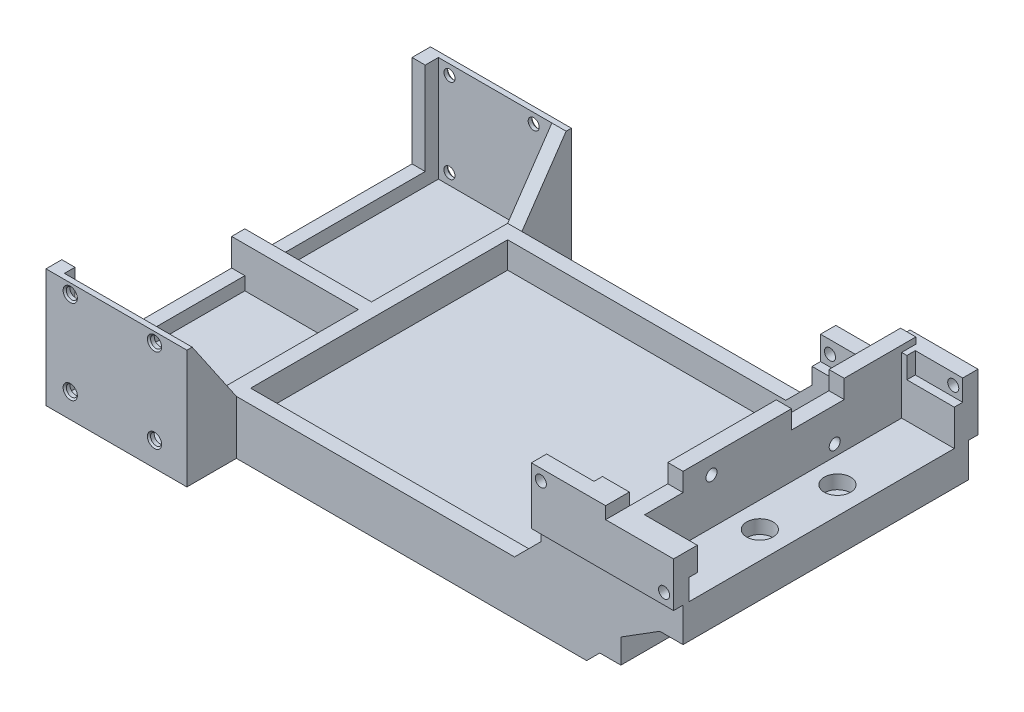
from build123d import *

# Parameters (mm, degrees)
SKETCH5_W                 = 70.3
SKETCH5_H                 = 48.8
BOSS_EXTRUDE2_DEPTH       = 5
BOSS_EXTRUDE4_START       = 2.7
BOSS_EXTRUDE4_DEPTH       = 2.7
BOSS_EXTRUDE5_DEPTH       = 1.575
SKETCH8_W                 = 17.5
SKETCH8_H                 = 54.2
BOSS_EXTRUDE6_DEPTH       = 6.5
BOSS_EXTRUDE7_DEPTH       = 54.2
SKETCH10_W                = 70.3
SKETCH10_H                = 48.8
CUT_EXTRUDE1_DEPTH        = 107.297545244
BOSS_EXTRUDE8_DEPTH       = 5
BOSS_EXTRUDE9_DEPTH       = 5
SKETCH13_W                = 4.5
SKETCH13_H                = 54.2
BOSS_EXTRUDE10_DEPTH      = 12
SKETCH15_R                = 1
CUT_EXTRUDE3_DEPTH        = 107.663316679
SKETCH16_R                = 2.5
CUT_EXTRUDE4_DEPTH        = 2.6
SKETCH17_W                = 3
SKETCH17_H                = 54.2
CUT_EXTRUDE5_DEPTH        = 107.663316679
SKETCH18_W                = 10
SKETCH18_H                = 3.5
CUT_EXTRUDE6_DEPTH        = 82.805657659
SKETCH19_R                = 1.05
CUT_EXTRUDE7_DEPTH        = 86.845300541
SKETCH20_W                = 1.6
SKETCH20_H                = 54.2
CUT_EXTRUDE8_DEPTH        = 12
BOSS_EXTRUDE11_DEPTH      = 1.8
BOSS_EXTRUDE11_DEPTH_BACK = 2.7
SKETCH21_W                = 10
SKETCH21_H                = 5
SKETCH21_R                = 1.05
BOSS_EXTRUDE13_DEPTH      = 1.8
BOSS_EXTRUDE13_DEPTH_BACK = 2.7
SKETCH23_W                = 27
SKETCH23_H                = 10.8
SKETCH23_R                = 1.05
CUT_EXTRUDE9_DEPTH        = 84.839880874
SKETCH24_W                = 13.5
SKETCH24_H                = 8.075
BOSS_EXTRUDE14_DEPTH      = 2.7
BOSS_EXTRUDE15_DEPTH      = 1.8
BOSS_EXTRUDE15_DEPTH_BACK = 2.7
SKETCH25_R                = 1.05
SKETCH26_W                = 9
SKETCH26_H                = 4.5
CUT_EXTRUDE10_DEPTH       = 1.6
SKETCH27_W                = 9
SKETCH27_H                = 4
CUT_EXTRUDE11_DEPTH       = 1.6
SKETCH28_W                = 9
SKETCH28_H                = 4
CUT_EXTRUDE12_DEPTH       = 1.6
SKETCH29_W                = 9
SKETCH29_H                = 4
CUT_EXTRUDE13_DEPTH       = 1.6
SKETCH30_W                = 14.720747113
SKETCH30_H                = 8.075
BOSS_EXTRUDE16_DEPTH      = 2.7
SKETCH31_W                = 93.25
SKETCH31_H                = 54.2
BOSS_EXTRUDE17_DEPTH      = 2.5
SKETCH33_W                = 24.05
SKETCH33_H                = 2.5
BOSS_EXTRUDE18_DEPTH      = 10.2
SKETCH36_W                = 24.05
SKETCH36_H                = 9.4
BOSS_EXTRUDE20_DEPTH      = 2.5
SKETCH37_W                = 24.05
SKETCH37_H                = 1
BOSS_EXTRUDE21_DEPTH      = 20
CUT_EXTRUDE14_REACH       = 123.231
SKETCH38_R                = 1.05
BOSS_EXTRUDE22_START      = -2.5
SKETCH39_W                = 2.7
SKETCH39_H                = 9.4
BOSS_EXTRUDE22_DEPTH      = 10.2
SKETCH40_W                = 2.7
SKETCH40_H                = 1
BOSS_EXTRUDE23_DEPTH      = 12.3
BOSS_EXTRUDE24_DEPTH      = 2.7
SKETCH42_W                = 2.5
SKETCH42_H                = 2
BOSS_EXTRUDE25_DEPTH      = 20
SKETCH43_W                = 24.05
SKETCH43_H                = 9.4
BOSS_EXTRUDE26_DEPTH      = 2.5
SKETCH44_W                = 24.05
SKETCH44_H                = 1
BOSS_EXTRUDE27_DEPTH      = 20
BOSS_EXTRUDE30_START      = -2.5
SKETCH45_W                = 2.7
SKETCH45_H                = 9.4
BOSS_EXTRUDE30_DEPTH      = 10.2
BOSS_EXTRUDE31_DEPTH      = 2.7
SKETCH47_W                = 2.5
SKETCH47_H                = 2.5
BOSS_EXTRUDE32_DEPTH      = 20
CUT_EXTRUDE15_START       = -1
SKETCH48_R                = 1.05
CUT_EXTRUDE15_DEPTH       = 1
SKETCH49_W                = 2.5
SKETCH49_H                = 66.5
BOSS_EXTRUDE33_DEPTH      = 2.5
CHAMFER1_SIZE             = 0.3
CHAMFER2_SIZE             = 2.5
CHAMFER3_SIZE             = 5


with BuildPart() as part:
    # Sketch5 → Boss-Extrude2 (new body)
    with BuildSketch(Plane(origin=(0, 0, 0), x_dir=(1, 0, 0), z_dir=(0, 1, 0))):
        with BuildLine():
            Line((87.15, 27.1), (11.45, 27.1))
            Line((11.45, 27.1), (11.45, -27.1))
            Line((11.45, -27.1), (87.15, -27.1))
            Line((87.15, -27.1), (87.15, -3.871759936))
            ThreePointArc((87.15, -3.871759936), (86.105, 0), (87.15, 3.871759936))
            Line((87.15, 3.871759936), (87.15, 27.1))
        make_face()
        with Locations((49.3, 0)):
            Rectangle(SKETCH5_W, SKETCH5_H, mode=Mode.SUBTRACT)
    extrude(amount=BOSS_EXTRUDE2_DEPTH)

    # Sketch6 → Boss-Extrude4 (add)
    with BuildSketch(Plane.XZ.offset(BOSS_EXTRUDE4_START)):
        with BuildLine():
            Line((87.15, -3.871759936), (87.15, -27.1))
            Line((87.15, -27.1), (11.45, -27.1))
            Line((11.45, -27.1), (11.45, 27.1))
            Line((11.45, 27.1), (87.15, 27.1))
            Line((87.15, 27.1), (87.15, 3.871759936))
            ThreePointArc((87.15, 3.871759936), (86.105, 0), (87.15, -3.871759936))
        make_face()
    extrude(amount=-BOSS_EXTRUDE4_DEPTH)

    # Sketch7 → Boss-Extrude5 (add)
    with BuildSketch(Plane(origin=(0, 5, 0), x_dir=(1, 0, 0), z_dir=(0, 1, 0))):
        with BuildLine():
            Line((87.15, -27.1), (79.15, -27.1))
            Line((79.15, -27.1), (79.15, -24.4))
            Line((79.15, -24.4), (84.45, -24.4))
            Line((84.45, -24.4), (84.45, 24.4))
            Line((84.45, 24.4), (79.15, 24.4))
            Line((79.15, 24.4), (79.15, 27.1))
            Line((79.15, 27.1), (87.15, 27.1))
            Line((87.15, 27.1), (87.15, 3.871759936))
            ThreePointArc((87.15, 3.871759936), (86.105, 0), (87.15, -3.871759936))
            Line((87.15, -3.871759936), (87.15, -27.1))
        make_face()
    extrude(amount=BOSS_EXTRUDE5_DEPTH)

    # Sketch8 → Boss-Extrude6 (add)
    with BuildSketch(Plane(origin=(0, 6.575, 0), x_dir=(1, 0, 0), z_dir=(0, 1, 0))):
        with Locations((93.2, 0)):
            Rectangle(SKETCH8_W, SKETCH8_H)
    extrude(amount=BOSS_EXTRUDE6_DEPTH)

    # Sketch9 → Boss-Extrude7 (add, through all)
    with BuildSketch(Plane.XY.offset(27.1)):
        Polygon((84.45, 13.075), (79.15, 6.575), (84.45, 6.575), align=None)
    extrude(amount=-BOSS_EXTRUDE7_DEPTH)

    # Sketch10 → Cut-Extrude1 (cut, through all)
    with BuildSketch(Plane(origin=(0, 0, 0), x_dir=(1, 0, 0), z_dir=(0, 1, 0))):
        with Locations((49.3, 0)):
            Rectangle(SKETCH10_W, SKETCH10_H)
    extrude(amount=CUT_EXTRUDE1_DEPTH, mode=Mode.SUBTRACT)

    # Sketch11 → Boss-Extrude8 (add)
    with BuildSketch(Plane.XY.offset(27.1)):
        Polygon((94.55, 6.575), (87.15, 1.9375), (87.15, 6.575), align=None)
    extrude(amount=-BOSS_EXTRUDE8_DEPTH)

    # Sketch12 → Boss-Extrude9 (add)
    with BuildSketch(Plane(origin=(0, 0, -27.1), x_dir=(-1, 0, 0), z_dir=(0, 0, -1))):
        Polygon((-94.55, 6.575), (-87.15, 1.9375), (-87.15, 6.575), align=None)
    extrude(amount=-BOSS_EXTRUDE9_DEPTH)

    # Sketch13 → Boss-Extrude10 (add)
    with BuildSketch(Plane(origin=(0, 13.075, 0), x_dir=(1, 0, 0), z_dir=(0, 1, 0))):
        with Locations((86.7, 0)):
            Rectangle(SKETCH13_W, SKETCH13_H)
    extrude(amount=BOSS_EXTRUDE10_DEPTH)

    # Sketch15 → Cut-Extrude3 (cut, through all)
    with BuildSketch(Plane(origin=(0, 13.075, 0), x_dir=(1, 0, 0), z_dir=(0, 1, 0))):
        with Locations(Location((93.8, 7.366, 0), (0, 0, 270))):
            Circle(SKETCH15_R)
        with Locations(Location((93.8, -7.366, 0), (0, 0, 270))):
            Circle(SKETCH15_R)
    extrude(amount=-CUT_EXTRUDE3_DEPTH, mode=Mode.SUBTRACT)

    # Sketch16 → Cut-Extrude4 (cut)
    with BuildSketch(Plane(origin=(0, 13.075, 0), x_dir=(1, 0, 0), z_dir=(0, 1, 0))):
        with Locations(Location((93.8, 7.366, 0), (0, 0, 270))):
            Circle(SKETCH16_R)
        with Locations(Location((93.8, -7.366, 0), (0, 0, 270))):
            Circle(SKETCH16_R)
    extrude(amount=-CUT_EXTRUDE4_DEPTH, mode=Mode.SUBTRACT)

    # Sketch17 → Cut-Extrude5 (cut, through all)
    with BuildSketch(Plane(origin=(0, 13.075, 0), x_dir=(1, 0, 0), z_dir=(0, 1, 0))):
        with Locations((100.45, 0)):
            Rectangle(SKETCH17_W, SKETCH17_H)
    extrude(amount=-CUT_EXTRUDE5_DEPTH, mode=Mode.SUBTRACT)

    # Sketch18 → Cut-Extrude6 (cut, through all)
    with BuildSketch(Plane.ZY.offset(-84.45)):
        with Locations((-8.5, 23.325)):
            Rectangle(SKETCH18_W, SKETCH18_H)
    extrude(amount=-CUT_EXTRUDE6_DEPTH, mode=Mode.SUBTRACT)

    # Sketch19 → Cut-Extrude7 (cut, through all)
    with BuildSketch(Plane(origin=(88.95, 0, 0), x_dir=(0, 0, -1), z_dir=(1, 0, 0))):
        with Locations((-11.7, 21.775)):
            Circle(SKETCH19_R)
        with Locations((11.7, 15.175)):
            Circle(SKETCH19_R)
    extrude(amount=-CUT_EXTRUDE7_DEPTH, mode=Mode.SUBTRACT)

    # Sketch20 → Cut-Extrude8 (cut)
    with BuildSketch(Plane(origin=(0, 25.075, 0), x_dir=(1, 0, 0), z_dir=(0, 1, 0))):
        with Locations((85.25, 0)):
            Rectangle(SKETCH20_W, SKETCH20_H)
    extrude(amount=-CUT_EXTRUDE8_DEPTH, mode=Mode.SUBTRACT)

    # Sketch21 → Boss-Extrude11 (add, two sides: drawn at the far end of the back side and taken through both)
    with BuildSketch(Plane.XY.offset(27.1).offset(-BOSS_EXTRUDE11_DEPTH_BACK)):
        with Locations((93.95, 15.575)):
            Rectangle(SKETCH21_W, SKETCH21_H)
        with Locations((97.15, 15.175)):
            Circle(SKETCH21_R, mode=Mode.SUBTRACT)
    extrude(amount=BOSS_EXTRUDE11_DEPTH + BOSS_EXTRUDE11_DEPTH_BACK)

    # Sketch23 → Boss-Extrude13 (add, two sides: drawn at the far end of the back side and taken through both)
    with BuildSketch(Plane.XY.offset(27.1).offset(-BOSS_EXTRUDE13_DEPTH_BACK)):
        with Locations((85.45, 18.475)):
            Rectangle(SKETCH23_W, SKETCH23_H)
        with Locations((73.75, 21.775)):
            Circle(SKETCH23_R, mode=Mode.SUBTRACT)
        with Locations((97.15, 15.175)):
            Circle(SKETCH23_R, mode=Mode.SUBTRACT)
    extrude(amount=BOSS_EXTRUDE13_DEPTH + BOSS_EXTRUDE13_DEPTH_BACK)

    # Sketch22 → Cut-Extrude9 (cut, through all)
    with BuildSketch(Plane.ZY.offset(-86.05)):
        Polygon((27.1, 25.075), (33.66511691, 25.075), (33.66511691, 21.575), (27.1, 21.575), (17.1, 21.575), (17.1, 25.075), align=None)
    extrude(amount=-CUT_EXTRUDE9_DEPTH, mode=Mode.SUBTRACT)

    # Sketch24 → Boss-Extrude14 (add)
    with BuildSketch(Plane.XY.offset(27.1)):
        with Locations((78.7, 9.0375)):
            Rectangle(SKETCH24_W, SKETCH24_H)
    extrude(amount=-BOSS_EXTRUDE14_DEPTH)

    # Sketch25 → Boss-Extrude15 (add, two sides: drawn at the far end of the back side and taken through both)
    with BuildSketch(Plane(origin=(0, 0, -27.1), x_dir=(-1, 0, 0), z_dir=(0, 0, -1)).offset(-BOSS_EXTRUDE15_DEPTH_BACK)):
        Polygon((-98.95, 13.075), (-71.95, 13.075), (-71.95, 17.575), (-80.95, 17.575), (-86.05, 23.875), (-98.95, 23.875), align=None)
        with Locations((-97.15, 21.775)):
            Circle(SKETCH25_R, mode=Mode.SUBTRACT)
        with Locations((-73.75, 15.175)):
            Circle(SKETCH25_R, mode=Mode.SUBTRACT)
    extrude(amount=BOSS_EXTRUDE15_DEPTH + BOSS_EXTRUDE15_DEPTH_BACK)

    # Sketch26 → Cut-Extrude10 (cut)
    with BuildSketch(Plane.XY.offset(-24.4)):
        with Locations((76.45, 15.325)):
            Rectangle(SKETCH26_W, SKETCH26_H)
    extrude(amount=-CUT_EXTRUDE10_DEPTH, mode=Mode.SUBTRACT)

    # Sketch27 → Cut-Extrude11 (cut)
    with BuildSketch(Plane(origin=(0, 0, 24.4), x_dir=(-1, 0, 0), z_dir=(0, 0, -1))):
        with Locations((-76.45, 21.875)):
            Rectangle(SKETCH27_W, SKETCH27_H)
    extrude(amount=-CUT_EXTRUDE11_DEPTH, mode=Mode.SUBTRACT)

    # Sketch28 → Cut-Extrude12 (cut)
    with BuildSketch(Plane.XY.offset(-24.4)):
        with Locations((94.45, 21.875)):
            Rectangle(SKETCH28_W, SKETCH28_H)
    extrude(amount=-CUT_EXTRUDE12_DEPTH, mode=Mode.SUBTRACT)

    # Sketch29 → Cut-Extrude13 (cut)
    with BuildSketch(Plane(origin=(0, 0, 24.4), x_dir=(-1, 0, 0), z_dir=(0, 0, -1))):
        with Locations((-94.45, 15.075)):
            Rectangle(SKETCH29_W, SKETCH29_H)
    extrude(amount=-CUT_EXTRUDE13_DEPTH, mode=Mode.SUBTRACT)

    # Sketch30 → Boss-Extrude16 (add)
    with BuildSketch(Plane(origin=(0, 0, -27.1), x_dir=(-1, 0, 0), z_dir=(0, 0, -1))):
        with Locations((-79.310373556, 9.0375)):
            Rectangle(SKETCH30_W, SKETCH30_H)
    extrude(amount=-BOSS_EXTRUDE16_DEPTH)

    # Sketch31 → Boss-Extrude17 (add)
    with BuildSketch(Plane.XZ.offset(2.7)):
        with Locations((34.025, 0)):
            Rectangle(SKETCH31_W, SKETCH31_H)
    extrude(amount=BOSS_EXTRUDE17_DEPTH)

    # Sketch33 → Boss-Extrude18 (add)
    with BuildSketch(Plane.XZ.offset(5.2)):
        with Locations((-0.575, 0)):
            Rectangle(SKETCH33_W, SKETCH33_H)
    extrude(amount=-BOSS_EXTRUDE18_DEPTH)

    # Sketch36 → Boss-Extrude20 (add)
    with BuildSketch(Plane.XZ.offset(5.2)):
        with Locations((-0.575, 31.8)):
            Rectangle(SKETCH36_W, SKETCH36_H)
    extrude(amount=-BOSS_EXTRUDE20_DEPTH)

    # Sketch37 → Boss-Extrude21 (add)
    with BuildSketch(Plane(origin=(0, -2.7, 0), x_dir=(1, 0, 0), z_dir=(0, 1, 0))):
        with Locations((-0.575, -36)):
            Rectangle(SKETCH37_W, SKETCH37_H)
    extrude(amount=BOSS_EXTRUDE21_DEPTH)

    # Sketch38 → Cut-Extrude14 (cut, up to next)
    with BuildSketch(Plane.XY.offset(36.5), mode=Mode.PRIVATE) as cut_extrude14_sk1:
        with Locations((8, 15.4)):
            Circle(SKETCH38_R)
    cut_extrude14_tool1 = extrude(cut_extrude14_sk1.sketch, amount=-CUT_EXTRUDE14_REACH, mode=Mode.PRIVATE) & part.part
    # Sketch38 → Cut-Extrude14 (cut, up to next)
    with BuildSketch(Plane.XY.offset(36.5), mode=Mode.PRIVATE) as cut_extrude14_sk2:
        with Locations((8, -0.6)):
            Circle(SKETCH38_R)
    cut_extrude14_tool2 = extrude(cut_extrude14_sk2.sketch, amount=-CUT_EXTRUDE14_REACH, mode=Mode.PRIVATE) & part.part
    # Sketch38 → Cut-Extrude14 (cut, up to next)
    with BuildSketch(Plane.XY.offset(36.5), mode=Mode.PRIVATE) as cut_extrude14_sk3:
        with Locations((-8, 15.4)):
            Circle(SKETCH38_R)
    cut_extrude14_tool3 = extrude(cut_extrude14_sk3.sketch, amount=-CUT_EXTRUDE14_REACH, mode=Mode.PRIVATE) & part.part
    # Sketch38 → Cut-Extrude14 (cut, up to next)
    with BuildSketch(Plane.XY.offset(36.5), mode=Mode.PRIVATE) as cut_extrude14_sk4:
        with Locations((-8, -0.6)):
            Circle(SKETCH38_R)
    cut_extrude14_tool4 = extrude(cut_extrude14_sk4.sketch, amount=-CUT_EXTRUDE14_REACH, mode=Mode.PRIVATE) & part.part
    add(cut_extrude14_tool1.solids().sort_by_distance((8, 15.4, 36.5))[0], mode=Mode.SUBTRACT)
    add(cut_extrude14_tool2.solids().sort_by_distance((8, -0.6, 36.5))[0], mode=Mode.SUBTRACT)
    add(cut_extrude14_tool3.solids().sort_by_distance((-8, 15.4, 36.5))[0], mode=Mode.SUBTRACT)
    add(cut_extrude14_tool4.solids().sort_by_distance((-8, -0.6, 36.5))[0], mode=Mode.SUBTRACT)

    # Sketch39 → Boss-Extrude22 (add)
    with BuildSketch(Plane(origin=(0, -2.7, 0), x_dir=(1, 0, 0), z_dir=(0, 1, 0)).offset(BOSS_EXTRUDE22_START)):
        with Locations((12.8, -31.8)):
            Rectangle(SKETCH39_W, SKETCH39_H)
    extrude(amount=BOSS_EXTRUDE22_DEPTH)

    # Sketch40 → Boss-Extrude23 (add)
    with BuildSketch(Plane(origin=(0, 5, 0), x_dir=(1, 0, 0), z_dir=(0, 1, 0))):
        with Locations((12.8, -36)):
            Rectangle(SKETCH40_W, SKETCH40_H)
    extrude(amount=BOSS_EXTRUDE23_DEPTH)

    # Sketch41 → Boss-Extrude24 (add)
    with BuildSketch(Plane(origin=(14.15, 0, 0), x_dir=(0, 0, -1), z_dir=(1, 0, 0))):
        Polygon((-27.1, 5), (-35.5, 17.3), (-35.5, 5), align=None)
    extrude(amount=-BOSS_EXTRUDE24_DEPTH)

    # Sketch42 → Boss-Extrude25 (add)
    with BuildSketch(Plane(origin=(0, -2.7, 0), x_dir=(1, 0, 0), z_dir=(0, 1, 0))):
        with Locations((-11.35, -34.5)):
            Rectangle(SKETCH42_W, SKETCH42_H)
    extrude(amount=BOSS_EXTRUDE25_DEPTH)

    # Sketch43 → Boss-Extrude26 (add)
    with BuildSketch(Plane(origin=(0, -2.7, 0), x_dir=(1, 0, 0), z_dir=(0, 1, 0))):
        with Locations((-0.575, 31.8)):
            Rectangle(SKETCH43_W, SKETCH43_H)
    extrude(amount=-BOSS_EXTRUDE26_DEPTH)

    # Sketch44 → Boss-Extrude27 (add)
    with BuildSketch(Plane(origin=(0, -2.7, 0), x_dir=(1, 0, 0), z_dir=(0, 1, 0))):
        with Locations((-0.575, 36)):
            Rectangle(SKETCH44_W, SKETCH44_H)
    extrude(amount=BOSS_EXTRUDE27_DEPTH)

    # Sketch45 → Boss-Extrude30 (add)
    with BuildSketch(Plane(origin=(0, -2.7, 0), x_dir=(1, 0, 0), z_dir=(0, 1, 0)).offset(BOSS_EXTRUDE30_START)):
        with Locations((12.8, 31.8)):
            Rectangle(SKETCH45_W, SKETCH45_H)
    extrude(amount=BOSS_EXTRUDE30_DEPTH)

    # Sketch46 → Boss-Extrude31 (add)
    with BuildSketch(Plane(origin=(14.15, 0, 0), x_dir=(0, 0, -1), z_dir=(1, 0, 0))):
        Polygon((27.1, 5), (35.5, 17.3), (36.5, 17.3), (36.5, 5), align=None)
    extrude(amount=-BOSS_EXTRUDE31_DEPTH)

    # Sketch47 → Boss-Extrude32 (add)
    with BuildSketch(Plane(origin=(0, -2.7, 0), x_dir=(1, 0, 0), z_dir=(0, 1, 0))):
        with Locations((-11.35, 34.25)):
            Rectangle(SKETCH47_W, SKETCH47_H)
    extrude(amount=BOSS_EXTRUDE32_DEPTH)

    # Sketch48 → Cut-Extrude15 (cut)
    with BuildSketch(Plane(origin=(0, 0, -36.5), x_dir=(-1, 0, 0), z_dir=(0, 0, -1)).offset(CUT_EXTRUDE15_START)):
        with Locations(Location((8, 15.4, 0), (0, 0, 180))):
            Circle(SKETCH48_R)
        with Locations(Location((-8, 15.4, 0), (0, 0, 180))):
            Circle(SKETCH48_R)
        with Locations(Location((-8, -0.6, 0), (0, 0, 180))):
            Circle(SKETCH48_R)
        with Locations(Location((8, -0.6, 0), (0, 0, 180))):
            Circle(SKETCH48_R)
    extrude(amount=CUT_EXTRUDE15_DEPTH, mode=Mode.SUBTRACT)

    # Sketch49 → Boss-Extrude33 (add)
    with BuildSketch(Plane(origin=(0, -2.7, 0), x_dir=(1, 0, 0), z_dir=(0, 1, 0))):
        with Locations((-11.35, -0.25)):
            Rectangle(SKETCH49_W, SKETCH49_H)
    extrude(amount=BOSS_EXTRUDE33_DEPTH)

    # Chamfer1
    chamfer1_edges = [part.edges().sort_by_distance(p)[0] for p in [
        (6.95, -0.6, 36.5),
        (-9.05, 15.4, 36.5),
        (-9.05, -0.6, 36.5),
        (6.95, 15.4, 36.5),
        (-9.05, -0.6, -36.5),
        (6.95, -0.6, -36.5),
        (6.95, 15.4, -36.5),
        (-9.05, 15.4, -36.5),
    ]]
    chamfer(chamfer1_edges, length=CHAMFER1_SIZE)

    # Chamfer2
    chamfer2_edges = [part.edges().sort_by_distance(p)[0] for p in [
        (80.65, -2.7, 0),
    ]]
    chamfer(chamfer2_edges, length=CHAMFER2_SIZE - 0.0001)  # a hair under: the kernel refuses the full size

    # Chamfer3
    chamfer3_edges = [part.edges().sort_by_distance(p)[0] for p in [
        (71.95, 5, 25.75),
        (71.95, 5, -25.75),
    ]]
    chamfer(chamfer3_edges, length=CHAMFER3_SIZE)


solid = part.part
